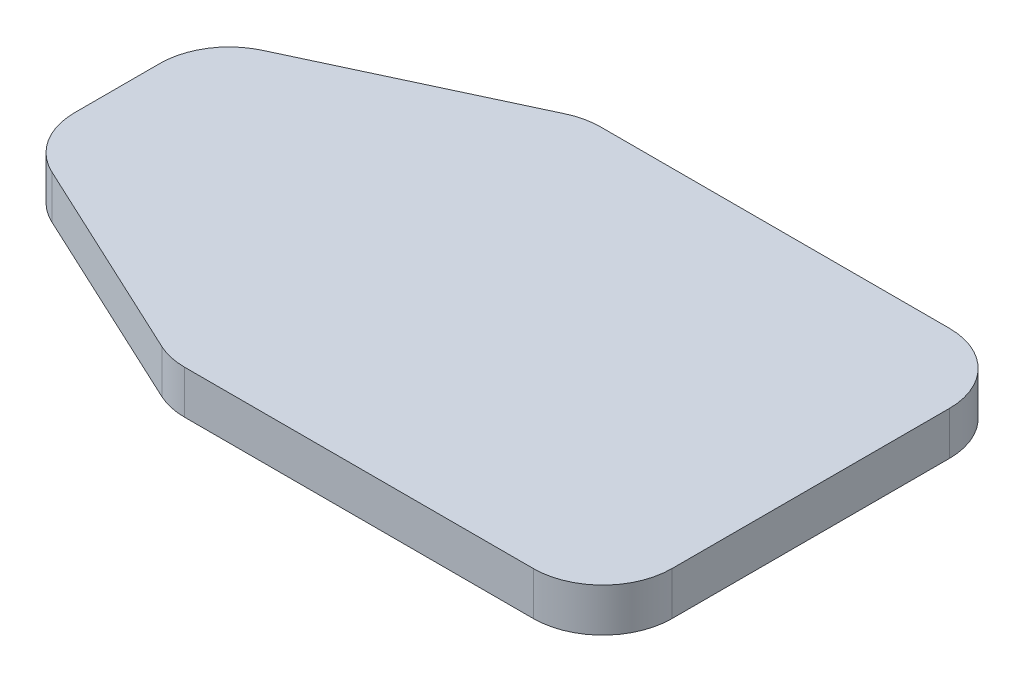
from build123d import *

# Parameters (mm, degrees)
BOSS_EXTRUDE1_DEPTH = 3.175
FILLET2_R           = 5.08


with BuildPart() as part:
    # Sketch1 → Boss-Extrude1 (new body)
    with BuildSketch(Plane(origin=(0, 0, 0), x_dir=(1, 0, 0), z_dir=(0, 1, 0))):
        Polygon((-6.35, 15.24), (-25.4, 6.35), (-25.4, -6.35), (-6.35, -15.24), (25.4, -15.24), (25.4, 15.24), align=None)
    extrude(amount=BOSS_EXTRUDE1_DEPTH)

    # Fillet2
    fillet2_edges = [part.edges().sort_by_distance(p)[0] for p in [
        (25.4, 1.5875, 15.24),
        (25.4, 1.5875, -15.24),
        (-6.35, 1.5875, -15.24),
        (-25.4, 1.5875, -6.35),
        (-25.4, 1.5875, 6.35),
        (-6.35, 1.5875, 15.24),
    ]]
    fillet(fillet2_edges, radius=FILLET2_R)


solid = part.part
